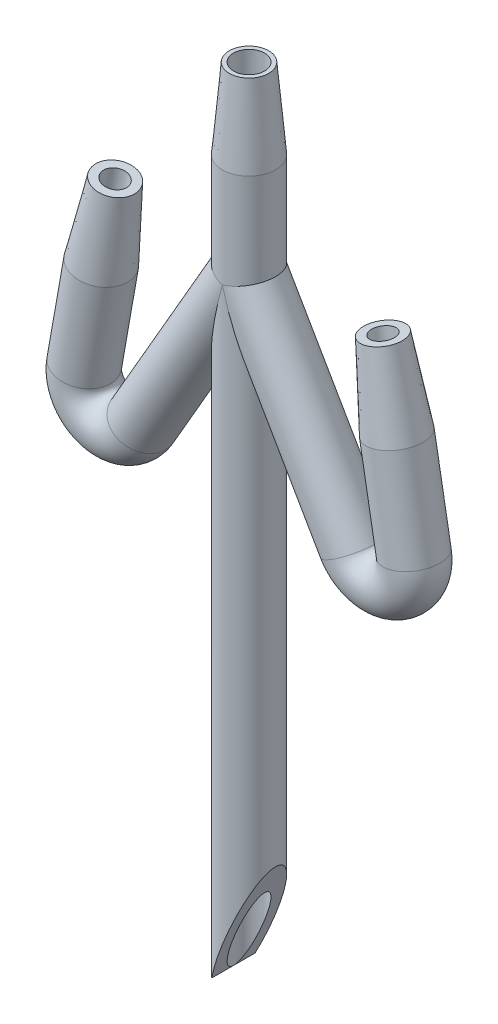
from build123d import *
from OCP.BRepFilletAPI import BRepFilletAPI_MakeChamfer

# Parameters (mm, degrees)
SKETCH1_R                       = 3
SKETCH1_R_2                     = 1.75
BOSS_EXTRUDE1_DEPTH             = 88.9
CUT_EXTRUDE1_DEPTH              = 90.001179767
CUT_EXTRUDE1_DEPTH_BACK         = 90.001179767
SKETCH4_R                       = 0.6
CUT_EXTRUDE3_DEPTH              = 76.2
CUT_EXTRUDE3_DIRECTION_2_REACH  = 65.853
SKETCH6_R                       = 3
SKETCH6_R_2                     = 0.6
BOSS_EXTRUDE2_DEPTH             = 10
BOSS_EXTRUDE2_DIRECTION_2_REACH = 59.527
SKETCH8_R                       = 3
SKETCH8_R_2                     = 0.6
CHAMFER2_SIZE                   = 0.69841539
CHAMFER2_SIZE_2                 = 20
CHAMFER1_SIZE                   = 9
CHAMFER1_SIZE2                  = 0.787397972


with BuildPart() as part:
    # Sketch1 → Boss-Extrude1 (new body)
    with BuildSketch(Plane(origin=(0, 0, 0), x_dir=(1, 0, 0), z_dir=(0, 1, 0))):
        with Locations(Location((0, 0, 0), (0, 0, 270))):
            Circle(SKETCH1_R)
        with Locations(Location((0, 0, 0), (0, 0, 270))):
            Circle(SKETCH1_R_2, mode=Mode.SUBTRACT)
    extrude(amount=BOSS_EXTRUDE1_DEPTH)

    # Sketch2 → Cut-Extrude1 (cut, two sides: drawn at the far end of the back side and taken through both)
    with BuildSketch(Plane.XY.offset(-CUT_EXTRUDE1_DEPTH_BACK)):
        Polygon((-1.75, 0), (3, 12), (3, 0), align=None)
    extrude(amount=CUT_EXTRUDE1_DEPTH + CUT_EXTRUDE1_DEPTH_BACK, mode=Mode.SUBTRACT)

    # Sketch4 → Cut-Extrude3 (cut)
    with BuildSketch(Plane(origin=(-3, 63.5, 0), x_dir=(-0.8660254037844363, 0.5000000000000043, 0), z_dir=(-0.5000000000000042, -0.8660254037844362, 0))):
        with Locations(Location((0, 0, 0), (0, 0, 180))):
            Circle(SKETCH4_R)
    cut_extrude3 = extrude(amount=CUT_EXTRUDE3_DEPTH, mode=Mode.SUBTRACT)

    # Sketch4 → Cut-Extrude3 direction 2 (cut, up to next)
    with BuildSketch(Plane(origin=(-3, 63.5, 0), x_dir=(-0.8660254037844363, 0.5000000000000043, 0), z_dir=(-0.5000000000000042, -0.8660254037844362, 0)), mode=Mode.PRIVATE) as cut_extrude3_direction_2_sk1:
        with Locations(Location((0, 0, 0), (0, 0, 180))):
            Circle(SKETCH4_R)
    cut_extrude3_direction_2_tool1 = extrude(cut_extrude3_direction_2_sk1.sketch, amount=-CUT_EXTRUDE3_DIRECTION_2_REACH, mode=Mode.PRIVATE) & part.part
    cut_extrude3_direction_2 = cut_extrude3_direction_2_tool1.solids().sort_by_distance((-3, 63.5, 0))[0]
    add(cut_extrude3_direction_2, mode=Mode.SUBTRACT)

    # Sketch6 → Boss-Extrude2 (add)
    with BuildSketch(Plane(origin=(-7, 56.57179677, 0), x_dir=(-0.8660254037844363, 0.5000000000000043, 0), z_dir=(-0.5000000000000042, -0.8660254037844362, 0))):
        with Locations(Location((0, 0, 0), (0, 0, 180))):
            Circle(SKETCH6_R)
        with Locations(Location((0, 0, 0), (0, 0, 180))):
            Circle(SKETCH6_R_2, mode=Mode.SUBTRACT)
    boss_extrude2 = extrude(amount=BOSS_EXTRUDE2_DEPTH)

    # Sketch6 → Boss-Extrude2 direction 2 (add, up to next)
    with BuildSketch(Plane(origin=(-7, 56.57179677, 0), x_dir=(-0.8660254037844363, 0.5000000000000043, 0), z_dir=(-0.5000000000000042, -0.8660254037844362, 0)), mode=Mode.PRIVATE) as boss_extrude2_direction_2_sk1:
        with Locations(Location((0, 0, 0), (0, 0, 180))):
            Circle(SKETCH6_R)
        with Locations(Location((0, 0, 0), (0, 0, 180))):
            Circle(SKETCH6_R_2, mode=Mode.SUBTRACT)
    boss_extrude2_direction_2_tool1 = extrude(boss_extrude2_direction_2_sk1.sketch, amount=-BOSS_EXTRUDE2_DIRECTION_2_REACH, mode=Mode.PRIVATE) - part.part
    boss_extrude2_direction_2 = boss_extrude2_direction_2_tool1.solids().sort_by_distance((-9.524592, 58.02937, 0))[0]
    add(boss_extrude2_direction_2)

    # Mirror2: Cut-Extrude3, Cut-Extrude3 direction 2, Boss-Extrude2, Boss-Extrude2 direction 2 across plane
    add(cut_extrude3.mirror(Plane(origin=(0, 0, 0), x_dir=(0, 0, 1), z_dir=(1, 0, 0))), mode=Mode.SUBTRACT)
    add(cut_extrude3_direction_2.mirror(Plane(origin=(0, 0, 0), x_dir=(0, 0, 1), z_dir=(1, 0, 0))), mode=Mode.SUBTRACT)
    add(boss_extrude2.mirror(Plane(origin=(0, 0, 0), x_dir=(0, 0, 1), z_dir=(1, 0, 0))))
    add(boss_extrude2_direction_2.mirror(Plane(origin=(0, 0, 0), x_dir=(0, 0, 1), z_dir=(1, 0, 0))))

    # Sweep1: sweep along a path in Sketch7
    with BuildLine(Plane.XY) as sweep1_path:
        Line((-15.066359238, 69.98781664), (-18.539322791, 50.29166158))
        ThreePointArc((-18.539322791, 50.29166158), (-16.268239819, 46.358030485), (-12, 47.911542732))
    # Sketch8 → Sweep1 (sweep)
    with BuildSketch(Plane(origin=(17.74630657, 30.737504626, 0), x_dir=(0.8660254037844362, -0.5000000000000046, 0), z_dir=(-0.5000000000000044, -0.866025403784436, 0))):
        with Locations((-34.348076211, 0)):
            Circle(SKETCH8_R)
        with Locations((-34.348076211, 0)):
            Circle(SKETCH8_R_2, mode=Mode.SUBTRACT)
    sweep1 = sweep(path=sweep1_path.line)

    # Mirror3: Sweep1 across plane
    add(sweep1.mirror(Plane(origin=(0, 0, 0), x_dir=(0, 0, 1), z_dir=(1, 0, 0))))

    # Chamfer2
    # the kernel refuses this chamfer: 20, 0.69841539 mm, written as the material it takes off along each edge
    with BuildSketch(Plane(origin=(-15.066359238, 69.98781664, 0), x_dir=(-0.9848077530122084, 0.17364817766692878, 0), z_dir=(0, 0, 1))) as chamfer2_piece_1:
        Polygon((0.6 + CHAMFER2_SIZE, 0), (0.6, CHAMFER2_SIZE_2), (0.6, 0), align=None)
    revolve(axis=Axis((-15.066359238, 69.98781664, 0), (-0.173648177666934, -0.9848077530122075, 0)), mode=Mode.SUBTRACT)
    with BuildSketch(Plane(origin=(15.066359238, 69.98781664, 0), x_dir=(0.9848077530122084, 0.17364817766692878, 0), z_dir=(0, 0, 1))) as chamfer2_piece_2:
        Polygon((0.6 + CHAMFER2_SIZE, 0), (0.6, -CHAMFER2_SIZE_2), (0.6, 0), align=None)
    revolve(axis=Axis((15.066359238, 69.98781664, 0), (-0.173648177666934, 0.9848077530122075, 0)), mode=Mode.SUBTRACT)

    # Chamfer1: one chamfer whose edges measure the first distance from different faces: ONE call of the kernel's chamfer builder (chamfer() names one face for all edges)
    chamfer1_edges_1 = [part.edges().sort_by_distance(p)[0] for p in [
        (0, 88.9, -3),
    ]]
    chamfer1_side_1 = [part.faces().sort_by_distance(p)[0] for p in [
        (0, 78.798076211, -3),
    ]]
    chamfer1_edges_2 = [part.edges().sort_by_distance(p)[0] for p in [
        (-12.111935979, 69.466872107, 0),
    ]]
    chamfer1_side_2 = [part.faces().sort_by_distance(p)[0] for p in [
        (-13.848417755, 59.618794577, 0),
    ]]
    chamfer1_edges_3 = [part.edges().sort_by_distance(p)[0] for p in [
        (12.111935979, 69.466872107, 0),
    ]]
    chamfer1_side_3 = [part.faces().sort_by_distance(p)[0] for p in [
        (13.848417755, 59.618794577, 0),
    ]]
    chamfer1 = BRepFilletAPI_MakeChamfer(part.part.solid().wrapped)
    for e in chamfer1_edges_1:
        chamfer1.Add(CHAMFER1_SIZE, CHAMFER1_SIZE2, e.wrapped, chamfer1_side_1[0].wrapped)  # the first distance lies on this face
    for e in chamfer1_edges_2:
        chamfer1.Add(CHAMFER1_SIZE, CHAMFER1_SIZE2, e.wrapped, chamfer1_side_2[0].wrapped)  # the first distance lies on this face
    for e in chamfer1_edges_3:
        chamfer1.Add(CHAMFER1_SIZE, CHAMFER1_SIZE2, e.wrapped, chamfer1_side_3[0].wrapped)  # the first distance lies on this face
    add(Compound.cast(chamfer1.Shape()), mode=Mode.REPLACE)


solid = part.part
